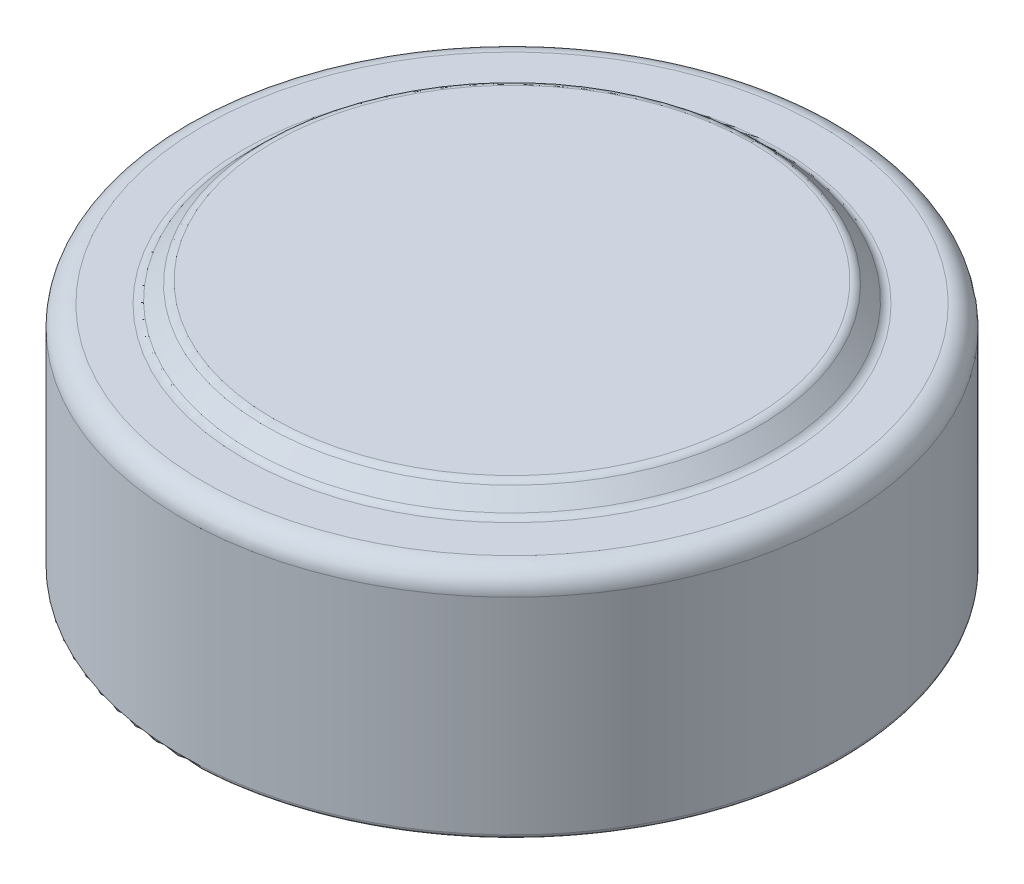
from build123d import *


with BuildPart() as part:
    # Sketch1 → Revolve1 (revolve)
    with BuildSketch(Plane.XY):
        with BuildLine():
            Line((0, 0), (-7.7, 0))
            ThreePointArc((-7.7, 0), (-7.770710678, 0.029289322), (-7.8, 0.1))
            Line((-7.8, 0.1), (-7.8, 4.97))
            ThreePointArc((-7.8, 4.97), (-7.653553391, 5.323553391), (-7.3, 5.47))
            Line((-7.3, 5.47), (-6.343553391, 5.47))
            ThreePointArc((-6.343553391, 5.47), (-6.247882533, 5.489030117), (-6.166776695, 5.543223305))
            Line((-6.166776695, 5.543223305), (-5.833223305, 5.876776695))
            ThreePointArc((-5.833223305, 5.876776695), (-5.752117467, 5.930969883), (-5.656446609, 5.95))
            Line((-5.656446609, 5.95), (0, 5.95))
            Line((0, 5.95), (0, 0))
        make_face()
    revolve(axis=Axis((0, 5.95, 0), (0, -1, 0)))


solid = part.part
